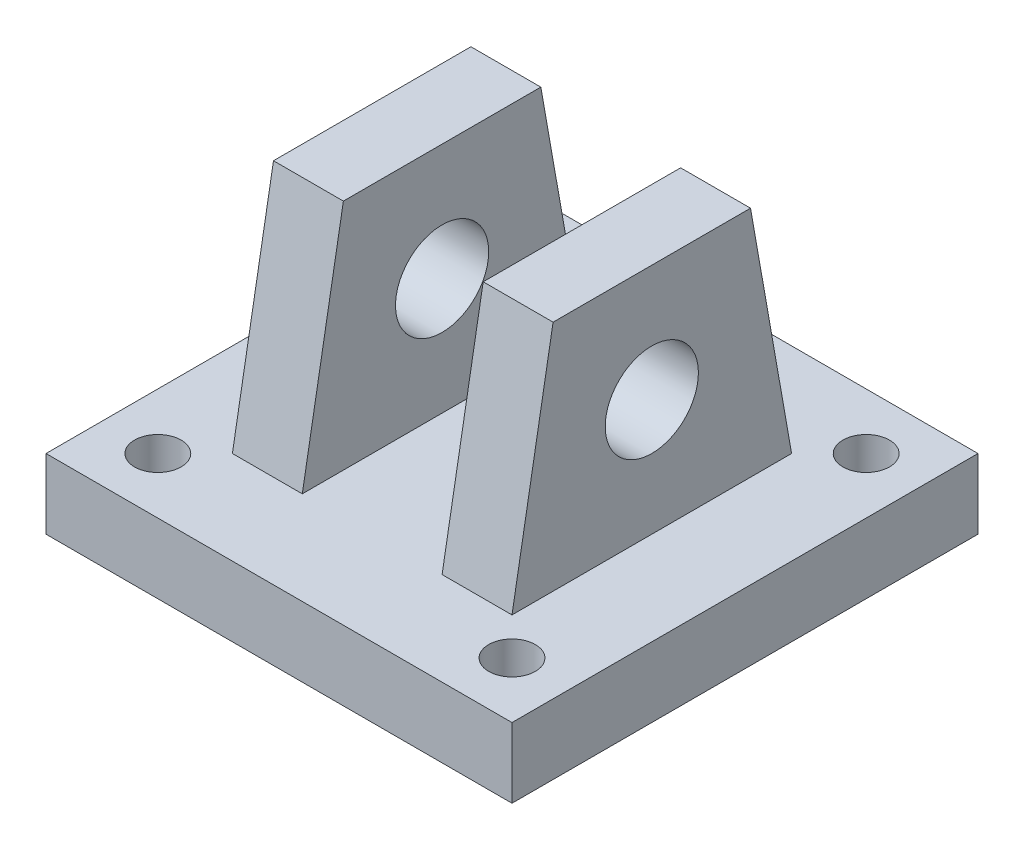
from build123d import *

# Parameters (mm, degrees)
SKETCH1_W          = 127
SKETCH1_H          = 127
EXTRUDE1_DEPTH     = 19.05
EXTRUDE2_DEPTH     = 38.1
SKETCH3_R          = 12.7
CUT_EXTRUDE1_DEPTH = 38.1
SKETCH4_W          = 38.1
SKETCH4_H          = 63.5
CUT_EXTRUDE2_DEPTH = 38.1
CUT_EXTRUDE3_REACH = 111.985
SKETCH5_R          = 6.35
CUT_EXTRUDE4_REACH = 111.985
SKETCH6_R          = 6.35
CUT_EXTRUDE5_REACH = 111.985
SKETCH8_R          = 6.35


with BuildPart() as part:
    # Sketch1 → Extrude1 (new body)
    with BuildSketch(Plane(origin=(0, 0, 0), x_dir=(1, 0, 0), z_dir=(0, 1, 0))):
        Rectangle(SKETCH1_W, SKETCH1_H)
    extrude(amount=-EXTRUDE1_DEPTH)

    # Sketch2 → Extrude2 (add, symmetric)
    with BuildSketch(Plane(origin=(0, 0, 0), x_dir=(0, 0, -1), z_dir=(1, 0, 0))):
        Polygon((38.1, 0), (26.903236725, 63.5), (-26.903236725, 63.5), (-38.1, 0), align=None)
    extrude(amount=EXTRUDE2_DEPTH, both=True)

    # Sketch3 → Cut-Extrude1 (cut, symmetric)
    with BuildSketch(Plane(origin=(0, 0, 0), x_dir=(0, 0, -1), z_dir=(1, 0, 0))):
        with Locations((0, 31.75)):
            Circle(SKETCH3_R)
    extrude(amount=CUT_EXTRUDE1_DEPTH, both=True, mode=Mode.SUBTRACT)

    # Sketch4 → Cut-Extrude2 (cut, symmetric)
    with BuildSketch(Plane.XY):
        with Locations((0, 31.75)):
            Rectangle(SKETCH4_W, SKETCH4_H)
    extrude(amount=CUT_EXTRUDE2_DEPTH, both=True, mode=Mode.SUBTRACT)

    # Sketch5 → Cut-Extrude3 (cut, up to next)
    with BuildSketch(Plane(origin=(0, 0, 0), x_dir=(1, 0, 0), z_dir=(0, 1, 0)), mode=Mode.PRIVATE) as cut_extrude3_sk1:
        with Locations((-48.26, 48.26)):
            Circle(SKETCH5_R)
    cut_extrude3_tool1 = extrude(cut_extrude3_sk1.sketch, amount=-CUT_EXTRUDE3_REACH, mode=Mode.PRIVATE) & part.part
    add(cut_extrude3_tool1.solids().sort_by_distance((-48.26, 0, -48.26))[0], mode=Mode.SUBTRACT)

    # Sketch6 → Cut-Extrude4 (cut, up to next)
    with BuildSketch(Plane(origin=(0, 0, 0), x_dir=(1, 0, 0), z_dir=(0, 1, 0)), mode=Mode.PRIVATE) as cut_extrude4_sk1:
        with Locations((48.26, 48.26)):
            Circle(SKETCH6_R)
    cut_extrude4_tool1 = extrude(cut_extrude4_sk1.sketch, amount=-CUT_EXTRUDE4_REACH, mode=Mode.PRIVATE) & part.part
    add(cut_extrude4_tool1.solids().sort_by_distance((48.26, 0, -48.26))[0], mode=Mode.SUBTRACT)

    # Sketch8 → Cut-Extrude5 (cut, up to next)
    with BuildSketch(Plane(origin=(0, 0, 0), x_dir=(1, 0, 0), z_dir=(0, 1, 0)), mode=Mode.PRIVATE) as cut_extrude5_sk1:
        with Locations((-48.26, -48.26)):
            Circle(SKETCH8_R)
    cut_extrude5_tool1 = extrude(cut_extrude5_sk1.sketch, amount=-CUT_EXTRUDE5_REACH, mode=Mode.PRIVATE) & part.part
    # Sketch8 → Cut-Extrude5 (cut, up to next)
    with BuildSketch(Plane(origin=(0, 0, 0), x_dir=(1, 0, 0), z_dir=(0, 1, 0)), mode=Mode.PRIVATE) as cut_extrude5_sk2:
        with Locations((48.26, -48.26)):
            Circle(SKETCH8_R)
    cut_extrude5_tool2 = extrude(cut_extrude5_sk2.sketch, amount=-CUT_EXTRUDE5_REACH, mode=Mode.PRIVATE) & part.part
    add(cut_extrude5_tool1.solids().sort_by_distance((-48.26, 0, 48.26))[0], mode=Mode.SUBTRACT)
    add(cut_extrude5_tool2.solids().sort_by_distance((48.26, 0, 48.26))[0], mode=Mode.SUBTRACT)


solid = part.part
